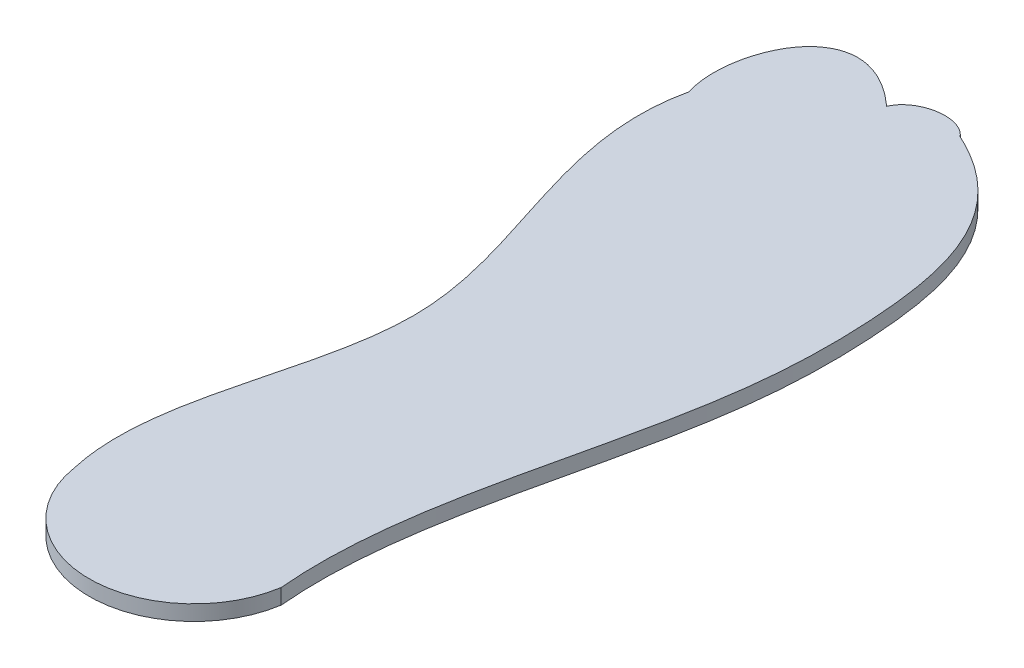
from build123d import *

# Parameters (mm, degrees)
BOSS_EXTRUDE1_DEPTH   = 5
CAVITY1_START         = 0.7
CAVITY1_OUTLINE_W     = 25
CAVITY1_OUTLINE_H     = 25
CAVITY1_DEPTH         = 1
CAVITY1_START_2       = 0.2
CAVITY1_2_OUTLINE_W   = 25
CAVITY1_2_OUTLINE_H   = 2.5
CAVITY1_2_OUTLINE_W_2 = 2.5
CAVITY1_2_OUTLINE_H_2 = 25
CAVITY1_2_OUTLINE_W_3 = 2.285503015
CAVITY1_2_DEPTH       = 0.8
CAVITY1_3_OUTLINE_W   = 25
CAVITY1_3_OUTLINE_H   = 25
CAVITY1_3_DEPTH       = 0.2
CAVITY1_4_OUTLINE_W   = 5
CAVITY1_4_OUTLINE_H   = 2.5
CAVITY1_4_OUTLINE_W_2 = 2.5
CAVITY1_4_OUTLINE_H_2 = 10
CAVITY1_4_OUTLINE_W_3 = 10
CAVITY1_4_OUTLINE_H_3 = 5
CAVITY1_4_DEPTH       = 0.5


# Read off the part's stored shape, not the designer's step: Cavity1
with BuildPart() as part:
    # Sketch1 → Boss-Extrude1 (new body)
    with BuildSketch(Plane(origin=(0, 0, 0), x_dir=(1, 0, 0), z_dir=(0, 1, 0))):
        with BuildLine():
            ThreePointArc((-40.679244353, -103.221523445), (-6.884583356, -132.122739902), (26.910077355, -103.221523111))
            add(Edge.make_bspline(
                [(10.32075615, 135.087420221), (39.402555208, 121.787875107), (48.095792581, 85.931785161), (48.363582245, 1.743673196), (22.570320599, -55.244701587), (26.910077355, -103.221523111)],
                knots=[0, 0, 0, 0, 0.296821126, 0.429544144, 1, 1, 1, 1], degree=3))
            add(Edge.make_bspline(
                [(-10.296198393, 131.704373688), (-7.252650356, 138.974935501), (5.280450445, 141.193491305), (10.32075615, 135.087420221)],
                knots=[0, 0, 0, 0, 1, 1, 1, 1], degree=3))
            add(Edge.make_bspline(
                [(-46.679244317, 103.587421062), (-52.785760987, 121.907427011), (-38.636955581, 157.574381944), (-10.296198393, 131.704373688)],
                knots=[0, 0, 0, 0, 1, 1, 1, 1], degree=3))
            add(Edge.make_bspline(
                [(-40.679244353, -103.221523445), (-48.424660229, -69.464624821), (-5.31250584, -0.275920012), (-54.797034308, 67.469917015), (-46.679244317, 103.587421062)],
                knots=[0, 0, 0, 0, 0.483382248, 1, 1, 1, 1], degree=3))
        make_face()
    extrude(amount=BOSS_EXTRUDE1_DEPTH)

    # Cavity1 outline → Cavity1 (cut)
    with BuildSketch(Plane(origin=(0, 0, 0), x_dir=(1, 0, 0), z_dir=(0, 1, 0)).offset(CAVITY1_START)):
        with Locations((22.8461193, 9.213988666)):
            Rectangle(CAVITY1_OUTLINE_W, CAVITY1_OUTLINE_H)
        with Locations((13.293848309, -40.883044077)):
            Rectangle(CAVITY1_OUTLINE_W, CAVITY1_OUTLINE_H)
        with Locations((27.285532226, 62.11773845)):
            Rectangle(CAVITY1_OUTLINE_W, CAVITY1_OUTLINE_H)
        with Locations((15.465881246, 110.60376868)):
            Rectangle(CAVITY1_OUTLINE_W, CAVITY1_OUTLINE_H)
        with Locations((-22.01559983, 68.107529984)):
            Rectangle(CAVITY1_OUTLINE_W, CAVITY1_OUTLINE_H)
        with Locations((-29.777504328, 118.602735793)):
            Rectangle(CAVITY1_OUTLINE_W, CAVITY1_OUTLINE_H)
    extrude(amount=CAVITY1_DEPTH, mode=Mode.SUBTRACT)

    # Cavity1 2 outline → Cavity1 2 (cut)
    with BuildSketch(Plane(origin=(0, 0, 0), x_dir=(1, 0, 0), z_dir=(0, 1, 0)).offset(CAVITY1_START_2)):
        with Locations((22.8461193, -2.036011334)):
            Rectangle(CAVITY1_2_OUTLINE_W, CAVITY1_2_OUTLINE_H)
        with Locations((22.8461193, 20.463988666)):
            Rectangle(CAVITY1_2_OUTLINE_W, CAVITY1_2_OUTLINE_H)
        with Locations((24.543848309, -40.883044077)):
            Rectangle(CAVITY1_2_OUTLINE_W_2, CAVITY1_2_OUTLINE_H_2)
        with Locations((2.043848309, -40.883044077)):
            Rectangle(CAVITY1_2_OUTLINE_W_2, CAVITY1_2_OUTLINE_H_2)
        with Locations((38.535532226, 62.11773845)):
            Rectangle(CAVITY1_2_OUTLINE_W_2, CAVITY1_2_OUTLINE_H_2)
        with Locations((16.035532226, 62.11773845)):
            Rectangle(CAVITY1_2_OUTLINE_W_2, CAVITY1_2_OUTLINE_H_2)
        with Locations((26.715881246, 110.60376868)):
            Rectangle(CAVITY1_2_OUTLINE_W_2, CAVITY1_2_OUTLINE_H_2)
        with Locations((4.215881246, 110.60376868)):
            Rectangle(CAVITY1_2_OUTLINE_W_2, CAVITY1_2_OUTLINE_H_2)
        with Locations((-10.76559983, 68.107529984)):
            Rectangle(CAVITY1_2_OUTLINE_W_2, CAVITY1_2_OUTLINE_H_2)
        with Locations((-33.26559983, 68.107529984)):
            Rectangle(CAVITY1_2_OUTLINE_W_2, CAVITY1_2_OUTLINE_H_2)
        with Locations((-40.813007343, 118.602735793)):
            Rectangle(CAVITY1_2_OUTLINE_W_2, CAVITY1_2_OUTLINE_H_2)
        with Locations((-18.420255836, 118.602735793)):
            Rectangle(CAVITY1_2_OUTLINE_W_3, CAVITY1_2_OUTLINE_H_2)
        with Locations((-5.933451551, -99.316079815)):
            Rectangle(CAVITY1_2_OUTLINE_W, CAVITY1_2_OUTLINE_H_2)
    extrude(amount=CAVITY1_2_DEPTH, mode=Mode.SUBTRACT)

    # Cavity1 3 outline → Cavity1 3 (cut)
    with BuildSketch(Plane(origin=(0, 0, 0), x_dir=(1, 0, 0), z_dir=(0, 1, 0))):
        with BuildLine():
            Line((-27.244520636, -26.19426531), (-31.802333845, -31.266533257))
            add(Edge.make_bspline(
                [(-31.802333845, -31.266533257), (-31.857130076, -31.511379507), (-31.912323208, -31.756243604), (-31.967893273, -32.001125538)],
                knots=[0.654214763, 0.654214763, 0.654214763, 0.654214763, 0.657769227, 0.657769227, 0.657769227, 0.657769227], degree=3))
            Line((-31.967893273, -32.001125538), (-27.147285967, -26.656479394))
            Line((-27.147285967, -26.656479394), (-20.982669031, -26.656479394))
            Line((-20.982669031, -26.656479394), (-19.615417401, -27.793744902))
            Line((-19.615417401, -27.793744902), (-18.621140453, -77.13111349))
            Line((-18.621140453, -77.13111349), (-18.621140453, -80.866329327))
            Line((-18.621140453, -80.866329327), (-16.147397443, -80.866329327))
            Line((-16.147397443, -80.866329327), (-16.147397443, -77.617012233))
            Line((-16.147397443, -77.617012233), (-17.824362748, -77.617012233))
            Line((-17.824362748, -77.617012233), (-19.249262259, -27.463288375))
            Line((-19.249262259, -27.463288375), (-20.774916419, -26.19426531))
            Line((-20.774916419, -26.19426531), (-27.244520636, -26.19426531))
        make_face()
        with BuildLine():
            add(Edge.make_bspline(
                [(-28.591698238, -11.029304155), (-28.608493948, -11.261176506), (-28.626146933, -11.49306524), (-28.644640026, -11.724970348)],
                knots=[0.556087489, 0.556087489, 0.556087489, 0.556087489, 0.559467316, 0.559467316, 0.559467316, 0.559467316], degree=3))
            Line((-28.644640026, -11.724970348), (-22.753733016, -4.9177719))
            Line((-22.753733016, -4.9177719), (-33.009952722, 38.410668499))
            Line((-33.009952722, 38.410668499), (-41.266120413, 61.719735077))
            Line((-41.266120413, 61.719735077), (-40.331527073, 92.415616002))
            Line((-40.331527073, 92.415616002), (-38.571382662, 94.220432026))
            Line((-38.571382662, 94.220432026), (-19.020758891, 94.123138856))
            Line((-19.020758891, 94.123138856), (-18.54571307, 94.476391707))
            Line((-18.54571307, 94.476391707), (-18.54571307, 96.052344807))
            Line((-18.54571307, 96.052344807), (-16.92880412, 96.052344807))
            Line((-16.92880412, 96.052344807), (-16.92880412, 99.681596017))
            Line((-16.92880412, 99.681596017), (-19.635003561, 99.681596017))
            Line((-19.635003561, 99.681596017), (-19.635003561, 96.052344807))
            Line((-19.635003561, 96.052344807), (-19.020758891, 96.052344807))
            Line((-19.020758891, 96.052344807), (-19.020758891, 94.961007518))
            Line((-19.020758891, 94.961007518), (-19.505374702, 94.476391707))
            Line((-19.505374702, 94.476391707), (-38.725431089, 94.374480453))
            Line((-38.725431089, 94.374480453), (-40.595802322, 92.504109221))
            Line((-40.595802322, 92.504109221), (-41.535905715, 61.627255516))
            Line((-41.535905715, 61.627255516), (-33.517826587, 38.236574685))
            Line((-33.517826587, 38.236574685), (-23.302816405, -4.9177719))
            Line((-23.302816405, -4.9177719), (-28.591698238, -11.029304155))
        make_face()
        with BuildLine():
            add(Edge.make_bspline(
                [(-28.919269438, -14.633400148), (-28.961371009, -15.020836554), (-29.005614654, -15.408318511), (-29.051920462, -15.79584598)],
                knots=[0.573592476, 0.573592476, 0.573592476, 0.573592476, 0.579235717, 0.579235717, 0.579235717, 0.579235717], degree=3))
            Line((-29.051920462, -15.79584598), (-19.505374702, -4.9177719))
            Line((-19.505374702, -4.9177719), (-29.920036263, 36.809670409))
            Line((-29.920036263, 36.809670409), (-29.59467727, 38.236574685))
            Line((-29.59467727, 38.236574685), (-11.676516222, 44.11307801))
            Line((-11.676516222, 44.11307801), (-11.137257107, 44.727551637))
            Line((-11.137257107, 44.727551637), (-11.137257107, 45.607529984))
            Line((-11.137257107, 45.607529984), (-9.51559983, 45.607529984))
            Line((-9.51559983, 45.607529984), (-9.51559983, 49.722751467))
            Line((-9.51559983, 49.722751467), (-12.271337975, 49.722751467))
            Line((-12.271337975, 49.722751467), (-12.271337975, 45.607529984))
            Line((-12.271337975, 45.607529984), (-11.676516222, 45.607529984))
            Line((-11.676516222, 45.607529984), (-11.676516222, 44.796108782))
            Line((-11.676516222, 44.796108782), (-12.271337975, 44.11307801))
            Line((-12.271337975, 44.11307801), (-30.321777288, 38.555961577))
            Line((-30.321777288, 38.555961577), (-30.719962048, 36.809670409))
            Line((-30.719962048, 36.809670409), (-20.458351925, -4.9177719))
            Line((-20.458351925, -4.9177719), (-28.919269438, -14.633400148))
        make_face()
        with BuildLine():
            add(Edge.make_bspline(
                [(-29.450724938, -18.800272272), (-29.483423201, -19.024970044), (-29.516744594, -19.249683064), (-29.550673568, -19.474411324)],
                knots=[0.593814952, 0.593814952, 0.593814952, 0.593814952, 0.597085057, 0.597085057, 0.597085057, 0.597085057], degree=3))
            Line((-29.550673568, -19.474411324), (-16.666774234, -4.9177719))
            Line((-16.666774234, -4.9177719), (-24.012584031, 22.019955613))
            Line((-24.012584031, 22.019955613), (-5.072368046, 43.22388331))
            Line((-5.072368046, 43.22388331), (-5.072368046, 71.528382806))
            Line((-5.072368046, 71.528382806), (25.793848309, 86.230770356))
            Line((25.793848309, 86.230770356), (26.634335154, 88.10376868))
            Line((26.634335154, 88.10376868), (27.965881246, 88.10376868))
            Line((27.965881246, 88.10376868), (27.965881246, 91.304998663))
            Line((27.965881246, 91.304998663), (25.302789062, 91.304998663))
            Line((25.302789062, 91.304998663), (25.302789062, 88.10376868))
            Line((25.302789062, 88.10376868), (26.103096558, 88.10376868))
            Line((26.103096558, 88.10376868), (25.302789062, 86.230770356))
            Line((25.302789062, 86.230770356), (-5.741976446, 71.999886519))
            Line((-5.741976446, 71.999886519), (-5.741976446, 43.22388331))
            Line((-5.741976446, 43.22388331), (-24.50930743, 22.019955613))
            Line((-24.50930743, 22.019955613), (-17.163497633, -4.9177719))
            Line((-17.163497633, -4.9177719), (-29.450724938, -18.800272272))
        make_face()
        with BuildLine():
            add(Edge.make_bspline(
                [(-29.775998383, -20.913095129), (-29.804327228, -21.087799466), (-29.833003017, -21.262512997), (-29.86201845, -21.43723572)],
                knots=[0.604062324, 0.604062324, 0.604062324, 0.604062324, 0.606603777, 0.606603777, 0.606603777, 0.606603777], degree=3))
            Line((-29.86201845, -21.43723572), (-15.247077754, -4.986779848))
            Line((-15.247077754, -4.986779848), (-19.991749432, 19.753687532))
            Line((-19.991749432, 19.753687532), (37.488617412, 38.410668499))
            Line((37.488617412, 38.410668499), (38.176759173, 39.61773845))
            Line((38.176759173, 39.61773845), (39.785532226, 39.61773845))
            Line((39.785532226, 39.61773845), (39.785532226, 43.22388331))
            Line((39.785532226, 43.22388331), (37.232630467, 43.22388331))
            Line((37.232630467, 43.22388331), (37.232630467, 39.61773845))
            Line((37.232630467, 39.61773845), (37.722742298, 39.61773845))
            Line((37.722742298, 39.61773845), (37.232630467, 38.525539749))
            Line((37.232630467, 38.525539749), (-20.339679133, 19.97704123))
            Line((-20.339679133, 19.97704123), (-15.565407372, -4.9177719))
            Line((-15.565407372, -4.9177719), (-29.775998383, -20.913095129))
        make_face()
        with BuildLine():
            add(Edge.make_bspline(
                [(-30.180370025, -23.28065069), (-30.210846032, -23.450762159), (-30.241619444, -23.620882323), (-30.272683534, -23.791011178)],
                knots=[0.615540005, 0.615540005, 0.615540005, 0.615540005, 0.61801347, 0.61801347, 0.61801347, 0.61801347], degree=3))
            Line((-30.272683534, -23.791011178), (-13.981764797, -5.451315118))
            Line((-13.981764797, -5.451315118), (5.472266425, -1.067036387))
            Line((5.472266425, -1.067036387), (5.472266425, -3.286011334))
            Line((5.472266425, -3.286011334), (8.259442856, -3.286011334))
            Line((8.259442856, -3.286011334), (8.259442856, -0.65899713))
            Line((8.259442856, -0.65899713), (5.472266425, -0.65899713))
            Line((5.472266425, -0.65899713), (-14.183565953, -5.272057718))
            Line((-14.183565953, -5.272057718), (-30.180370025, -23.28065069))
        make_face()
        with BuildLine():
            add(Edge.make_bspline(
                [(-30.581305037, -25.433304606), (-30.605232294, -25.557207867), (-30.629302153, -25.681115729), (-30.653512016, -25.805028191)],
                knots=[0.625971141, 0.625971141, 0.625971141, 0.625971141, 0.627771951, 0.627771951, 0.627771951, 0.627771951], degree=3))
            Line((-30.653512016, -25.805028191), (-21.985943093, -16.15912346))
            Line((-21.985943093, -16.15912346), (-20.339679133, -15.769815959))
            Line((-20.339679133, -15.769815959), (-18.509916006, -16.3047706))
            Line((-18.509916006, -16.3047706), (-17.138809489, -17.381595528))
            Line((-17.138809489, -17.381595528), (-11.170188955, -60.40545128))
            Line((-11.170188955, -60.40545128), (-8.273621448, -62.814785632))
            Line((-8.273621448, -62.814785632), (20.600799896, -62.814785632))
            Line((20.600799896, -62.814785632), (23.334754171, -61.211389111))
            Line((23.334754171, -61.211389111), (23.334754171, -63.383044077))
            Line((23.334754171, -63.383044077), (25.793848309, -63.383044077))
            Line((25.793848309, -63.383044077), (25.793848309, -60.85994699))
            Line((25.793848309, -60.85994699), (23.445556816, -60.92666346))
            Line((23.445556816, -60.92666346), (20.459854127, -62.677704196))
            Line((20.459854127, -62.677704196), (-8.273621448, -62.677704196))
            Line((-8.273621448, -62.677704196), (-11.021734416, -60.202910563))
            Line((-11.021734416, -60.202910563), (-17.068884238, -17.3392383))
            Line((-17.068884238, -17.3392383), (-18.448993482, -16.096390713))
            Line((-18.448993482, -16.096390713), (-20.339679133, -15.543624594))
            Line((-20.339679133, -15.543624594), (-22.036599838, -15.944911371))
            Line((-22.036599838, -15.944911371), (-30.581305037, -25.433304606))
        make_face()
        with BuildLine():
            Line((-21.482019756, -24.884299781), (-18.32746309, -27.463288375))
            Line((-18.32746309, -27.463288375), (-17.39661533, -60.227340247))
            Line((-17.39661533, -60.227340247), (3.874012153, -77.617012233))
            Line((3.874012153, -77.617012233), (3.874012153, -85.793488089))
            Line((3.874012153, -85.793488089), (6.566548449, -85.793488089))
            Line((6.566548449, -85.793488089), (6.566548449, -81.816079815))
            Line((6.566548449, -81.816079815), (4.631771507, -81.816079815))
            Line((4.631771507, -81.816079815), (4.631771507, -77.572857103))
            Line((4.631771507, -77.572857103), (-16.897576325, -59.971669871))
            Line((-16.897576325, -59.971669871), (-17.824362748, -27.350569274))
            Line((-17.824362748, -27.350569274), (-21.482019756, -24.360274057))
            Line((-21.482019756, -24.360274057), (-27.631199431, -24.534976202))
            Line((-27.631199431, -24.534976202), (-31.204236161, -28.515437721))
            add(Edge.make_bspline(
                [(-31.204236161, -28.515437721), (-31.273329211, -28.843478776), (-31.343269917, -29.171551968), (-31.414010175, -29.499657274)],
                knots=[0.640898457, 0.640898457, 0.640898457, 0.640898457, 0.645663275, 0.645663275, 0.645663275, 0.645663275], degree=3))
            Line((-31.414010175, -29.499657274), (-27.244520636, -24.884299781))
            Line((-27.244520636, -24.884299781), (-21.482019756, -24.884299781))
        make_face()
        with BuildLine():
            add(Edge.make_bspline(
                [(-30.414273563, -24.555915478), (-30.449532861, -24.743870032), (-30.485134527, -24.931835185), (-30.521069494, -25.119810931)],
                knots=[0.62172011, 0.62172011, 0.62172011, 0.62172011, 0.624452321, 0.624452321, 0.624452321, 0.624452321], degree=3))
            Line((-30.521069494, -25.119810931), (-21.249391802, -14.824157442))
            Line((-21.249391802, -14.824157442), (-20.803400772, -14.56259474))
            Line((-20.803400772, -14.56259474), (-16.771944521, -15.741242511))
            Line((-16.771944521, -15.741242511), (-16.525006953, -15.963620386))
            Line((-16.525006953, -15.963620386), (-7.01163287, -56.192809018))
            Line((-7.01163287, -56.192809018), (-4.40017957, -58.804262318))
            Line((-4.40017957, -58.804262318), (-1.445624961, -58.804262318))
            Line((-1.445624961, -58.804262318), (0.66882873, -56.689808627))
            Line((0.66882873, -56.689808627), (0.66882873, -58.478737564))
            Line((0.66882873, -58.478737564), (3.668663973, -58.478737564))
            Line((3.668663973, -58.478737564), (3.668663973, -55.569481389))
            Line((3.668663973, -55.569481389), (1.13810646, -55.569481389))
            Line((1.13810646, -55.569481389), (-1.771149715, -58.478737564))
            Line((-1.771149715, -58.478737564), (-4.074654816, -58.478737564))
            Line((-4.074654816, -58.478737564), (-6.48838877, -56.06500361))
            Line((-6.48838877, -56.06500361), (-16.362150139, -15.641147855))
            Line((-16.362150139, -15.641147855), (-21.167691752, -14.236186333))
            Line((-21.167691752, -14.236186333), (-30.414273563, -24.555915478))
        make_face()
        with BuildLine():
            add(Edge.make_bspline(
                [(-29.988180344, -22.184656823), (-30.023540161, -22.390838636), (-30.059358311, -22.597033238), (-30.095622806, -22.803240622)],
                knots=[0.61022741, 0.61022741, 0.61022741, 0.61022741, 0.613226006, 0.613226006, 0.613226006, 0.613226006], degree=3))
            Line((-30.095622806, -22.803240622), (-14.462122144, -5.206302111))
            Line((-14.462122144, -5.206302111), (1.13810646, 19.322816792))
            Line((1.13810646, 19.322816792), (5.324670428, 19.322816792))
            Line((5.324670428, 19.322816792), (5.324670428, 22.019955613))
            Line((5.324670428, 22.019955613), (0.3461193, 22.019955613))
            Line((0.3461193, 22.019955613), (0.3461193, 19.322816792))
            Line((0.3461193, 19.322816792), (-14.70921458, -4.986779848))
            Line((-14.70921458, -4.986779848), (-29.988180344, -22.184656823))
        make_face()
        with BuildLine():
            add(Edge.make_bspline(
                [(-29.611108034, -19.870566935), (-29.636637797, -20.036216812), (-29.662492664, -20.201874966), (-29.688666407, -20.367541393)],
                knots=[0.599006517, 0.599006517, 0.599006517, 0.599006517, 0.601416758, 0.601416758, 0.601416758, 0.601416758], degree=3))
            Line((-29.688666407, -20.367541393), (-15.962757132, -4.9177719))
            Line((-15.962757132, -4.9177719), (-21.5751748, 19.97704123))
            Line((-21.5751748, 19.97704123), (13.556400518, 40.842418674))
            Line((13.556400518, 40.842418674), (15.702350297, 43.628902326))
            Line((15.702350297, 43.628902326), (15.702350297, 44.727551637))
            Line((15.702350297, 44.727551637), (17.227104088, 44.727551637))
            Line((17.227104088, 44.727551637), (17.227104088, 47.541456162))
            Line((17.227104088, 47.541456162), (14.318777413, 47.541456162))
            Line((14.318777413, 47.541456162), (14.318777413, 44.727551637))
            Line((14.318777413, 44.727551637), (15.119371675, 44.727551637))
            Line((15.119371675, 44.727551637), (15.119371675, 43.628902326))
            Line((15.119371675, 43.628902326), (12.785095576, 41.015636371))
            Line((12.785095576, 41.015636371), (-21.80513488, 20.048171692))
            Line((-21.80513488, 20.048171692), (-16.362150139, -4.9177719))
            Line((-16.362150139, -4.9177719), (-29.611108034, -19.870566935))
        make_face()
        with BuildLine():
            add(Edge.make_bspline(
                [(-29.211653259, -17.071370747), (-29.249505198, -17.3605738), (-29.288456231, -17.649802163), (-29.32847317, -17.939055818)],
                knots=[0.585426389, 0.585426389, 0.585426389, 0.585426389, 0.589636729, 0.589636729, 0.589636729, 0.589636729], degree=3))
            Line((-29.32847317, -17.939055818), (-17.90105672, -4.9177719))
            Line((-17.90105672, -4.9177719), (-25.700656491, 23.309522789))
            Line((-25.700656491, 23.309522789), (-6.530487702, 44.420314824))
            Line((-6.530487702, 44.420314824), (-6.530487702, 80.604390933))
            Line((-6.530487702, 80.604390933), (4.631771507, 93.323534131))
            Line((4.631771507, 93.323534131), (5.324670428, 93.323534131))
            Line((5.324670428, 93.323534131), (5.324670428, 96.374925636))
            Line((5.324670428, 96.374925636), (2.903590849, 96.374925636))
            Line((2.903590849, 96.374925636), (2.903590849, 93.32353413))
            Line((2.903590849, 93.32353413), (3.668663973, 93.32353413))
            Line((3.668663973, 93.32353413), (-7.493595235, 80.604390933))
            Line((-7.493595235, 80.604390933), (-7.493595235, 44.420314824))
            Line((-7.493595235, 44.420314824), (-26.020325308, 23.309522789))
            Line((-26.020325308, 23.309522789), (-18.54571307, -4.9177719))
            Line((-18.54571307, -4.9177719), (-29.211653259, -17.071370747))
        make_face()
        with BuildLine():
            add(Edge.make_bspline(
                [(-28.744132736, -12.8857876), (-28.769240437, -13.159876876), (-28.795481138, -13.433988996), (-28.822826516, -13.708123944)],
                knots=[0.565105971, 0.565105971, 0.565105971, 0.565105971, 0.569099657, 0.569099657, 0.569099657, 0.569099657], degree=3))
            Line((-28.822826516, -13.708123944), (-21.167691752, -4.9177719))
            Line((-21.167691752, -4.9177719), (-31.653140584, 38.555961577))
            Line((-31.653140584, 38.555961577), (-34.824939212, 47.541456162))
            Line((-34.824939212, 47.541456162), (-33.327392766, 50.471438337))
            Line((-33.327392766, 50.471438337), (-32.033412004, 50.471438337))
            Line((-32.033412004, 50.471438337), (-32.033412004, 53.209747247))
            Line((-32.033412004, 53.209747247), (-34.729852963, 53.209747247))
            Line((-34.729852963, 53.209747247), (-34.729852963, 50.471438337))
            Line((-34.729852963, 50.471438337), (-33.981079741, 50.471438337))
            Line((-33.981079741, 50.471438337), (-35.478626186, 47.541456162))
            Line((-35.478626186, 47.541456162), (-32.255540411, 38.410668499))
            Line((-32.255540411, 38.410668499), (-21.80513488, -4.9177719))
            Line((-21.80513488, -4.9177719), (-28.744132736, -12.8857876))
        make_face()
        with BuildLine():
            add(Edge.make_bspline(
                [(-28.471608233, -9.090825588), (-28.485498971, -9.361757518), (-28.500626432, -9.632711865), (-28.5169632, -9.903688616)],
                knots=[0.546667057, 0.546667057, 0.546667057, 0.546667057, 0.550617783, 0.550617783, 0.550617783, 0.550617783], degree=3))
            Line((-28.5169632, -9.903688616), (-24.241046751, -4.9177719))
            Line((-24.241046751, -4.9177719), (-34.631766592, 38.236574685))
            Line((-34.631766592, 38.236574685), (-42.169849002, 61.627255516))
            Line((-42.169849002, 61.627255516), (-40.967944387, 101.102735793))
            Line((-40.967944387, 101.102735793), (-39.563007343, 101.102735793))
            Line((-39.563007343, 101.102735793), (-39.563007343, 104.115071058))
            Line((-39.563007343, 104.115071058), (-42.169849002, 104.115071058))
            Line((-42.169849002, 104.115071058), (-42.007094412, 101.102735793))
            Line((-42.007094412, 101.102735793), (-41.406142105, 101.102735793))
            Line((-41.406142105, 101.102735793), (-42.60804672, 61.627255516))
            Line((-42.60804672, 61.627255516), (-35.266025225, 38.236574685))
            Line((-35.266025225, 38.236574685), (-24.892802184, -4.9177719))
            Line((-24.892802184, -4.9177719), (-28.471608233, -9.090825588))
        make_face()
        with Locations((-5.933451551, -99.316079815)):
            Rectangle(CAVITY1_3_OUTLINE_W, CAVITY1_3_OUTLINE_H)
    extrude(amount=CAVITY1_3_DEPTH, mode=Mode.SUBTRACT)

    # Cavity1 4 outline → Cavity1 4 (cut)
    with BuildSketch(Plane(origin=(0, 0, 0), x_dir=(1, 0, 0), z_dir=(0, 1, 0)).offset(CAVITY1_START_2)):
        with Locations((7.8461193, -2.036011334)):
            Rectangle(CAVITY1_4_OUTLINE_W, CAVITY1_4_OUTLINE_H)
        with Locations((24.543848309, -58.383044077)):
            Rectangle(CAVITY1_4_OUTLINE_W_2, CAVITY1_4_OUTLINE_H_2)
        with Locations((5.3461193, 20.463988666)):
            Rectangle(CAVITY1_4_OUTLINE_W_3, CAVITY1_4_OUTLINE_H)
        with Locations((2.043848309, -55.883044077)):
            Rectangle(CAVITY1_4_OUTLINE_W_2, CAVITY1_4_OUTLINE_H_3)
        with Locations((38.535532226, 44.61773845)):
            Rectangle(CAVITY1_4_OUTLINE_W_2, CAVITY1_4_OUTLINE_H_2)
        with Locations((16.035532226, 47.11773845)):
            Rectangle(CAVITY1_4_OUTLINE_W_2, CAVITY1_4_OUTLINE_H_3)
        with Locations((26.715881246, 93.10376868)):
            Rectangle(CAVITY1_4_OUTLINE_W_2, CAVITY1_4_OUTLINE_H_2)
        with Locations((4.215881246, 95.60376868)):
            Rectangle(CAVITY1_4_OUTLINE_W_2, CAVITY1_4_OUTLINE_H_3)
        with Locations((-10.76559983, 50.607529984)):
            Rectangle(CAVITY1_4_OUTLINE_W_2, CAVITY1_4_OUTLINE_H_2)
        with Locations((-33.26559983, 53.107529984)):
            Rectangle(CAVITY1_4_OUTLINE_W_2, CAVITY1_4_OUTLINE_H_3)
        with Locations((-40.813007343, 103.602735793)):
            Rectangle(CAVITY1_4_OUTLINE_W_2, CAVITY1_4_OUTLINE_H_3)
        Polygon((-17.277504328, 106.102735793), (-19.563007343, 106.102735793), (-19.563007343, 96.102735793), (-17.063007343, 96.102735793), (-17.063007343, 131.102735793), (-17.277504328, 131.102735793), align=None)
    extrude(amount=CAVITY1_4_DEPTH, mode=Mode.SUBTRACT)


solid = part.part
